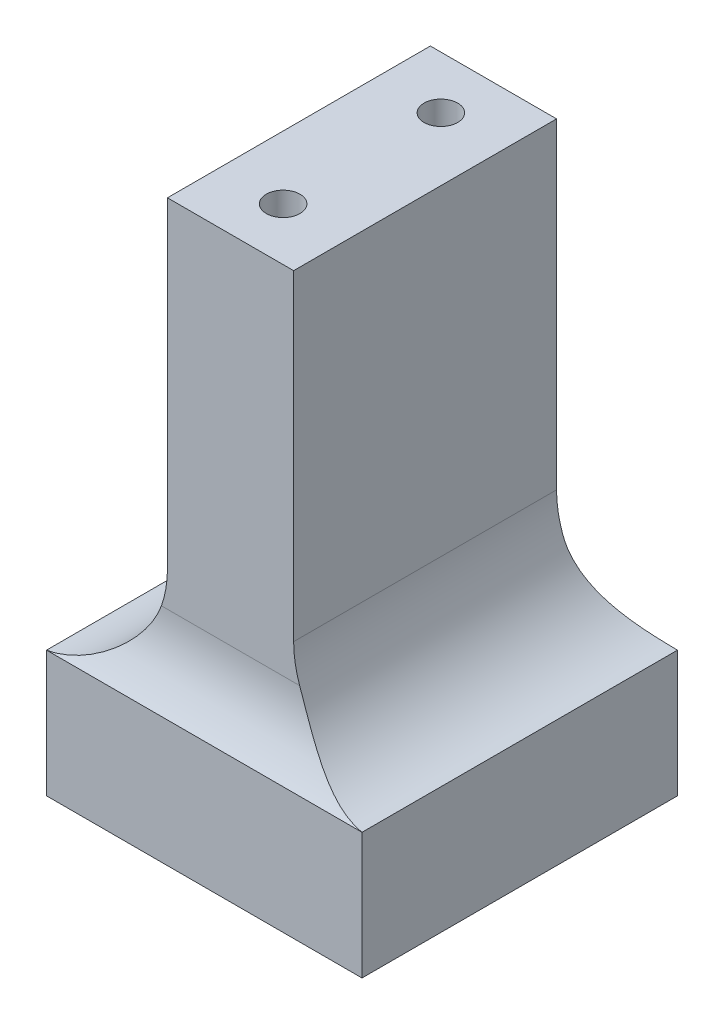
from build123d import *

# Parameters (mm, degrees)
SKETCH1_W           = 30
SKETCH1_H           = 30
BOSS_EXTRUDE1_DEPTH = 12
SKETCH2_W           = 12
SKETCH2_H           = 25
BOSS_EXTRUDE2_DEPTH = 40.5
SKETCH3_R           = 1.6
CUT_EXTRUDE1_DEPTH  = 10
FILLET1_R           = 10


with BuildPart() as part:
    # Sketch1 → Boss-Extrude1 (new body)
    with BuildSketch(Plane(origin=(0, 0, 0), x_dir=(1, 0, 0), z_dir=(0, 1, 0))):
        Rectangle(SKETCH1_W, SKETCH1_H)
    extrude(amount=BOSS_EXTRUDE1_DEPTH)

    # Sketch2 → Boss-Extrude2 (add)
    with BuildSketch(Plane(origin=(0, 12, 0), x_dir=(1, 0, 0), z_dir=(0, 1, 0))):
        Rectangle(SKETCH2_W, SKETCH2_H)
    extrude(amount=BOSS_EXTRUDE2_DEPTH)

    # Sketch3 → Cut-Extrude1 (cut)
    with BuildSketch(Plane(origin=(0, 52.5, 0), x_dir=(1, 0, 0), z_dir=(0, 1, 0))):
        with Locations(Location((0, -7.5, 0), (0, 0, 270))):
            Circle(SKETCH3_R)
        with Locations(Location((0, 7.5, 0), (0, 0, 270))):
            Circle(SKETCH3_R)
    extrude(amount=-CUT_EXTRUDE1_DEPTH, mode=Mode.SUBTRACT)

    # Fillet1
    # the kernel refuses this fillet: 10 mm, written as the material it adds along each edge
    with BuildSketch(Plane(origin=(6, 12, 12.5), x_dir=(1, 0, 0), z_dir=(0, 0, -1)), Plane(origin=(-6, 12, -12.5), x_dir=(-1, 0, 0), z_dir=(0, 0, 1))) as fillet1_piece_1:
        with BuildLine():
            CenterArc((10, -9.949874371), FILLET1_R, 95.739170477, 84.260829523)
            Line((0, -9.949874371), (-0.2, -9.949874371))
            Line((-0.2, -9.949874371), (-0.2, 0))
            Line((-0.2, 0), (0, 0.2))
            ThreePointArc((0, 0.2), (4.5, 0.2), (8.98, 0.198997487))
            Line((8.98, 0.198997487), (9, 0))
        make_face()
    extrude(amount=25)
    with BuildSketch(Plane(origin=(6, 12, -12.5), x_dir=(0, 0, -1), z_dir=(-1, 0, 0)), Plane(origin=(-6, 12, 12.5), x_dir=(0, 0, 1), z_dir=(1, 0, 0))) as fillet1_piece_2:
        with BuildLine():
            CenterArc((10, -6.614378278), FILLET1_R, 138.590377891, 41.409622109)
            Line((0, -6.614378278), (-0.2, -6.614378278))
            Line((-0.2, -6.614378278), (-0.2, 0))
            Line((-0.2, 0), (0, 0.2))
            ThreePointArc((0, 0.2), (1.25, 0.2), (2.35, 0.132287566))
            Line((2.35, 0.132287566), (2.5, 0))
        make_face()
    extrude(amount=12)
    with BuildSketch(Plane(origin=(6, 12, 37.374685928), x_dir=(1, 0, 0), z_dir=(0, 0, -1))) as fillet1_piece_3a_section:
        with BuildLine():
            CenterArc((10, -9.949874371), FILLET1_R, 95.739170477, 84.260829523)
            Line((0, -9.949874371), (-0.2, -9.949874371))
            Line((-0.2, -9.949874371), (-0.2, 0))
            Line((-0.2, 0), (0, 0.2))
            ThreePointArc((0, 0.2), (4.5, 0.2), (8.98, 0.198997487))
            Line((8.98, 0.198997487), (9, 0))
        make_face()
    fillet1_piece_3a = extrude(amount=49.874685928, mode=Mode.PRIVATE)
    fillet1_piece_3a = split(fillet1_piece_3a, bisect_by=Plane(origin=(8.162151556, 14.281986067, 15), z_dir=(0, 0, -1)), keep=Keep.TOP, mode=Mode.PRIVATE)
    fillet1_piece_3a = split(fillet1_piece_3a, bisect_by=Plane(origin=(8.162151556, 14.281986067, 12.5), z_dir=(0, 0, 1)), keep=Keep.TOP, mode=Mode.PRIVATE)
    with BuildSketch(Plane(origin=(-6, 12, 12.5), x_dir=(0, 0, 1), z_dir=(1, 0, 0))) as fillet1_piece_3b_section:
        with BuildLine():
            CenterArc((10, -6.614378278), FILLET1_R, 138.590377891, 41.409622109)
            Line((0, -6.614378278), (-0.2, -6.614378278))
            Line((-0.2, -6.614378278), (-0.2, 0))
            Line((-0.2, 0), (0, 0.2))
            ThreePointArc((0, 0.2), (1.25, 0.2), (2.35, 0.132287566))
            Line((2.35, 0.132287566), (2.5, 0))
        make_face()
    fillet1_piece_3b = extrude(amount=28.535945694, mode=Mode.PRIVATE)
    fillet1_piece_3b = split(fillet1_piece_3b, bisect_by=Plane(origin=(15, 13.814075663, 13.097749904), z_dir=(-1, 0, 0)), keep=Keep.TOP, mode=Mode.PRIVATE)
    fillet1_piece_3b = split(fillet1_piece_3b, bisect_by=Plane(origin=(6, 13.814075663, 13.097749904), z_dir=(1, 0, 0)), keep=Keep.TOP, mode=Mode.PRIVATE)
    fillet1_piece_3 = fillet1_piece_3a & fillet1_piece_3b
    add(fillet1_piece_3)
    with BuildSketch(Plane(origin=(6, 12, 12.5), x_dir=(1, 0, 0), z_dir=(0, 0, -1))) as fillet1_piece_4a_section:
        with BuildLine():
            CenterArc((10, -9.949874371), FILLET1_R, 95.739170477, 84.260829523)
            Line((0, -9.949874371), (-0.2, -9.949874371))
            Line((-0.2, -9.949874371), (-0.2, 0))
            Line((-0.2, 0), (0, 0.2))
            ThreePointArc((0, 0.2), (4.5, 0.2), (8.98, 0.198997487))
            Line((8.98, 0.198997487), (9, 0))
        make_face()
    fillet1_piece_4a = extrude(amount=49.874685928, mode=Mode.PRIVATE)
    fillet1_piece_4a = split(fillet1_piece_4a, bisect_by=Plane(origin=(8.162151556, 14.281986067, -15), z_dir=(0, 0, 1)), keep=Keep.TOP, mode=Mode.PRIVATE)
    fillet1_piece_4a = split(fillet1_piece_4a, bisect_by=Plane(origin=(8.162151556, 14.281986067, -12.5), z_dir=(0, 0, -1)), keep=Keep.TOP, mode=Mode.PRIVATE)
    with BuildSketch(Plane(origin=(22.535945694, 12, -12.5), x_dir=(0, 0, -1), z_dir=(-1, 0, 0))) as fillet1_piece_4b_section:
        with BuildLine():
            CenterArc((10, -6.614378278), FILLET1_R, 138.590377891, 41.409622109)
            Line((0, -6.614378278), (-0.2, -6.614378278))
            Line((-0.2, -6.614378278), (-0.2, 0))
            Line((-0.2, 0), (0, 0.2))
            ThreePointArc((0, 0.2), (1.25, 0.2), (2.35, 0.132287566))
            Line((2.35, 0.132287566), (2.5, 0))
        make_face()
    fillet1_piece_4b = extrude(amount=28.535945694, mode=Mode.PRIVATE)
    fillet1_piece_4b = split(fillet1_piece_4b, bisect_by=Plane(origin=(15, 13.814075663, -13.097749904), z_dir=(-1, 0, 0)), keep=Keep.TOP, mode=Mode.PRIVATE)
    fillet1_piece_4b = split(fillet1_piece_4b, bisect_by=Plane(origin=(6, 13.814075663, -13.097749904), z_dir=(1, 0, 0)), keep=Keep.TOP, mode=Mode.PRIVATE)
    fillet1_piece_4 = fillet1_piece_4a & fillet1_piece_4b
    add(fillet1_piece_4)
    with BuildSketch(Plane(origin=(-6, 12, -37.374685928), x_dir=(-1, 0, 0), z_dir=(0, 0, 1))) as fillet1_piece_5a_section:
        with BuildLine():
            CenterArc((10, -9.949874371), FILLET1_R, 95.739170477, 84.260829523)
            Line((0, -9.949874371), (-0.2, -9.949874371))
            Line((-0.2, -9.949874371), (-0.2, 0))
            Line((-0.2, 0), (0, 0.2))
            ThreePointArc((0, 0.2), (4.5, 0.2), (8.98, 0.198997487))
            Line((8.98, 0.198997487), (9, 0))
        make_face()
    fillet1_piece_5a = extrude(amount=49.874685928, mode=Mode.PRIVATE)
    fillet1_piece_5a = split(fillet1_piece_5a, bisect_by=Plane(origin=(-8.162151556, 14.281986067, -15), z_dir=(0, 0, 1)), keep=Keep.TOP, mode=Mode.PRIVATE)
    fillet1_piece_5a = split(fillet1_piece_5a, bisect_by=Plane(origin=(-8.162151556, 14.281986067, -12.5), z_dir=(0, 0, -1)), keep=Keep.TOP, mode=Mode.PRIVATE)
    with BuildSketch(Plane(origin=(6, 12, -12.5), x_dir=(0, 0, -1), z_dir=(-1, 0, 0))) as fillet1_piece_5b_section:
        with BuildLine():
            CenterArc((10, -6.614378278), FILLET1_R, 138.590377891, 41.409622109)
            Line((0, -6.614378278), (-0.2, -6.614378278))
            Line((-0.2, -6.614378278), (-0.2, 0))
            Line((-0.2, 0), (0, 0.2))
            ThreePointArc((0, 0.2), (1.25, 0.2), (2.35, 0.132287566))
            Line((2.35, 0.132287566), (2.5, 0))
        make_face()
    fillet1_piece_5b = extrude(amount=28.535945694, mode=Mode.PRIVATE)
    fillet1_piece_5b = split(fillet1_piece_5b, bisect_by=Plane(origin=(-15, 13.814075663, -13.097749904), z_dir=(1, 0, 0)), keep=Keep.TOP, mode=Mode.PRIVATE)
    fillet1_piece_5b = split(fillet1_piece_5b, bisect_by=Plane(origin=(-6, 13.814075663, -13.097749904), z_dir=(-1, 0, 0)), keep=Keep.TOP, mode=Mode.PRIVATE)
    fillet1_piece_5 = fillet1_piece_5a & fillet1_piece_5b
    add(fillet1_piece_5)
    with BuildSketch(Plane(origin=(-22.535945694, 12, 12.5), x_dir=(0, 0, 1), z_dir=(1, 0, 0))) as fillet1_piece_6a_section:
        with BuildLine():
            CenterArc((10, -6.614378278), FILLET1_R, 138.590377891, 41.409622109)
            Line((0, -6.614378278), (-0.2, -6.614378278))
            Line((-0.2, -6.614378278), (-0.2, 0))
            Line((-0.2, 0), (0, 0.2))
            ThreePointArc((0, 0.2), (1.25, 0.2), (2.35, 0.132287566))
            Line((2.35, 0.132287566), (2.5, 0))
        make_face()
    fillet1_piece_6a = extrude(amount=28.535945694, mode=Mode.PRIVATE)
    fillet1_piece_6a = split(fillet1_piece_6a, bisect_by=Plane(origin=(-15, 13.814075663, 13.097749904), z_dir=(1, 0, 0)), keep=Keep.TOP, mode=Mode.PRIVATE)
    fillet1_piece_6a = split(fillet1_piece_6a, bisect_by=Plane(origin=(-6, 13.814075663, 13.097749904), z_dir=(-1, 0, 0)), keep=Keep.TOP, mode=Mode.PRIVATE)
    with BuildSketch(Plane(origin=(-6, 12, -12.5), x_dir=(-1, 0, 0), z_dir=(0, 0, 1))) as fillet1_piece_6b_section:
        with BuildLine():
            CenterArc((10, -9.949874371), FILLET1_R, 95.739170477, 84.260829523)
            Line((0, -9.949874371), (-0.2, -9.949874371))
            Line((-0.2, -9.949874371), (-0.2, 0))
            Line((-0.2, 0), (0, 0.2))
            ThreePointArc((0, 0.2), (4.5, 0.2), (8.98, 0.198997487))
            Line((8.98, 0.198997487), (9, 0))
        make_face()
    fillet1_piece_6b = extrude(amount=49.874685928, mode=Mode.PRIVATE)
    fillet1_piece_6b = split(fillet1_piece_6b, bisect_by=Plane(origin=(-8.162151556, 14.281986067, 15), z_dir=(0, 0, -1)), keep=Keep.TOP, mode=Mode.PRIVATE)
    fillet1_piece_6b = split(fillet1_piece_6b, bisect_by=Plane(origin=(-8.162151556, 14.281986067, 12.5), z_dir=(0, 0, 1)), keep=Keep.TOP, mode=Mode.PRIVATE)
    fillet1_piece_6 = fillet1_piece_6a & fillet1_piece_6b
    add(fillet1_piece_6)


solid = part.part
